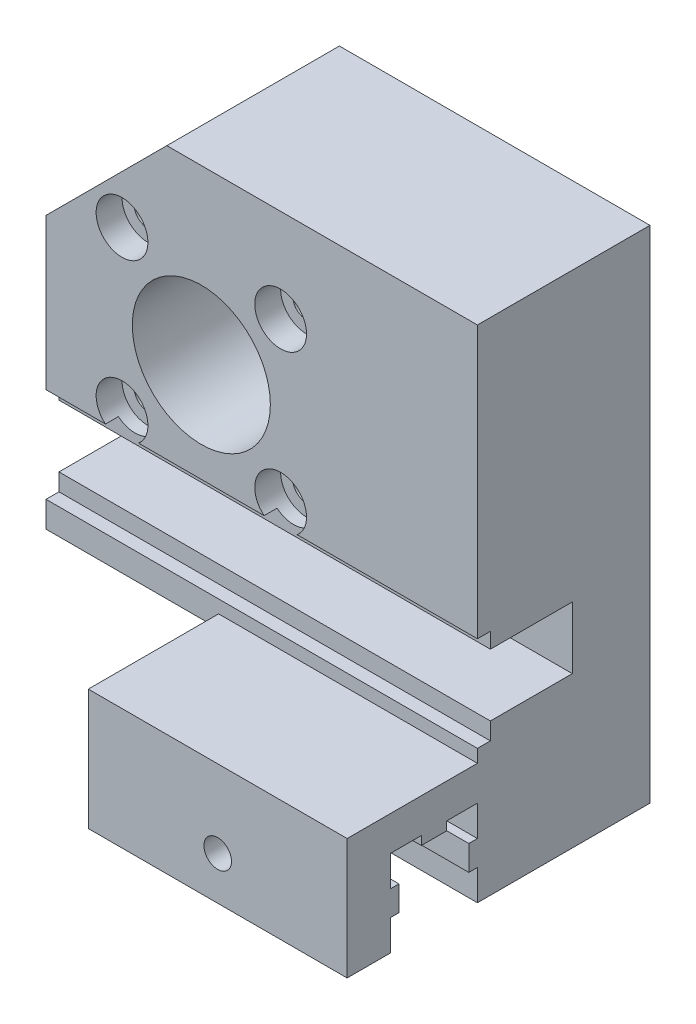
from build123d import *

# Parameters (mm, degrees)
ESQUISSE1_W                     = 50
ESQUISSE1_H                     = 45
MAIN_EXTRUSION_DEPTH            = 20
ESQUISSE5_R                     = 8
GEAR_LINEAR_HOLES_DEPTH         = 40.131189606
FIXING_EXTRUSION_DEPTH          = 25
ESQUISSE13_W                    = 50
ESQUISSE13_H                    = 7.2
ROLLINGBALLHORIZONTALHOLE_DEPTH = 11
FRONTHOLE_DEPTH                 = 20
ESQUISSE15_R                    = 1.6
BOTTOMFIXINGHOLE_DEPTH          = 56.832427853
ESQUISSE12_R                    = 16
REDUCTORMAINHOLE_DEPTH          = 5
REDUCTORFRONTFIXINGHOLE_DEPTH   = 3
ESQUISSE17_R                    = 1.6
MOTORFIXINGHOLE_DEPTH           = 53.832376437
ESQUISSE19_R                    = 3
ENL_V_MAT_EXTRU_5_DEPTH         = 3
SKETCH2_W                       = 1.5
SKETCH2_H                       = 11
CUTFORMAKERBEAMPROFILE_DEPTH    = 71.655926857
CUT_EXTRUDE1_DEPTH              = 48.804288511


with BuildPart() as part:
    # Esquisse1 → Main Extrusion (new body)
    with BuildSketch(Plane.XY):
        Rectangle(ESQUISSE1_W, ESQUISSE1_H)
    extrude(amount=MAIN_EXTRUSION_DEPTH)

    # Esquisse5 → Gear Linear Holes (cut, through all)
    with BuildSketch(Plane.XY.offset(20)):
        with Locations((-7, 2.5)):
            Circle(ESQUISSE5_R)
    extrude(amount=-GEAR_LINEAR_HOLES_DEPTH, mode=Mode.SUBTRACT)

    # Esquisse8 → Fixing Extrusion (add, symmetric)
    with BuildSketch(Plane(origin=(0, 0, 0), x_dir=(0, 0, -1), z_dir=(1, 0, 0))):
        Polygon((-20, -25.5), (-20, -29.05), (-21, -29.05), (-21, -31.95), (-20, -31.95), (-20, -35.5), (0, -35.5), (0, -21.5), (-35.1, -21.5), (-35.1, -35.5), (-30.1, -35.5), (-30.1, -31.95), (-29.1, -31.95), (-29.1, -29.05), (-30.1, -29.05), (-30.1, -25.5), (-26.5, -25.5), (-26.5, -26.5), (-23.6, -26.5), (-23.6, -25.5), align=None)
    extrude(amount=FIXING_EXTRUSION_DEPTH, both=True)

    # Esquisse13 → RollingBallHorizontalHole (cut)
    with BuildSketch(Plane.XY.offset(20)):
        with Locations((0, -14.4)):
            Rectangle(ESQUISSE13_W, ESQUISSE13_H)
    extrude(amount=-ROLLINGBALLHORIZONTALHOLE_DEPTH, mode=Mode.SUBTRACT)

    # Esquisse14 → FrontHole (cut)
    with BuildSketch(Plane.ZY.offset(25)):
        Polygon((0, -23), (20, -23), (20, -18), (35.1, -18), (35.1, -35.5), (0, -35.5), align=None)
    extrude(amount=-FRONTHOLE_DEPTH, mode=Mode.SUBTRACT)

    # Esquisse15 → BottomFixingHole (cut, through all)
    with BuildSketch(Plane.XY.offset(35.1)):
        with Locations((10, -30.5)):
            Circle(ESQUISSE15_R)
    extrude(amount=-BOTTOMFIXINGHOLE_DEPTH, mode=Mode.SUBTRACT)

    # Esquisse12 → ReductorMainHole (cut)
    with BuildSketch(Plane.XY):
        with Locations((-7, 2.5)):
            Circle(ESQUISSE12_R)
    extrude(amount=REDUCTORMAINHOLE_DEPTH, mode=Mode.SUBTRACT)

    # Esquisse16 → ReductorFrontFixingHole (cut)
    with BuildSketch(Plane(origin=(0, 0, 5), x_dir=(-1, 0, 0), z_dir=(0, 0, -1))):
        with BuildLine():
            Line((2.641101056, 11.5), (11.358898944, 11.5))
            ThreePointArc((11.358898944, 11.5), (17, 2.5), (11.358898944, -6.5))
            Line((11.358898944, -6.5), (2.641101056, -6.5))
            ThreePointArc((2.641101056, -6.5), (-3, 2.5), (2.641101056, 11.5))
        make_face()
    extrude(amount=-REDUCTORFRONTFIXINGHOLE_DEPTH, mode=Mode.SUBTRACT)

    # Esquisse17 → MotorFixingHole (cut, through all)
    with BuildSketch(Plane(origin=(0, 0, 5), x_dir=(-1, 0, 0), z_dir=(0, 0, -1))):
        with Locations((-2.192388155, 11.692388155)):
            Circle(ESQUISSE17_R)
        with Locations((16.192388155, 11.692388155)):
            Circle(ESQUISSE17_R)
        with Locations((-2.192388155, -6.692388155)):
            Circle(ESQUISSE17_R)
        with Locations((16.192388155, -6.692388155)):
            Circle(ESQUISSE17_R)
    extrude(amount=-MOTORFIXINGHOLE_DEPTH, mode=Mode.SUBTRACT)

    # Esquisse19 → Enlèv. mat.-Extru.5 (cut)
    with BuildSketch(Plane.XY.offset(20)):
        with Locations((-16.192388155, 11.692388155)):
            Circle(ESQUISSE19_R)
        with Locations((2.192388155, 11.692388155)):
            Circle(ESQUISSE19_R)
        with Locations((-16.192388155, -6.692388155)):
            Circle(ESQUISSE19_R)
        with Locations((2.192388155, -6.692388155)):
            Circle(ESQUISSE19_R)
    extrude(amount=-ENL_V_MAT_EXTRU_5_DEPTH, mode=Mode.SUBTRACT)

    # Sketch2 → CutForMakerBeamProfile (cut, through all)
    with BuildSketch(Plane(origin=(25, 0, 0), x_dir=(0, 0, -1), z_dir=(1, 0, 0))):
        with Locations((-19.25, -14.5)):
            Rectangle(SKETCH2_W, SKETCH2_H)
    extrude(amount=-CUTFORMAKERBEAMPROFILE_DEPTH, mode=Mode.SUBTRACT)

    # Sketch3 → Cut-Extrude1 (cut, through all)
    with BuildSketch(Plane.XY.offset(20)):
        Polygon((-11, 22.5), (-25, 8.5), (-25, 22.5), align=None)
    extrude(amount=-CUT_EXTRUDE1_DEPTH, mode=Mode.SUBTRACT)


solid = part.part
